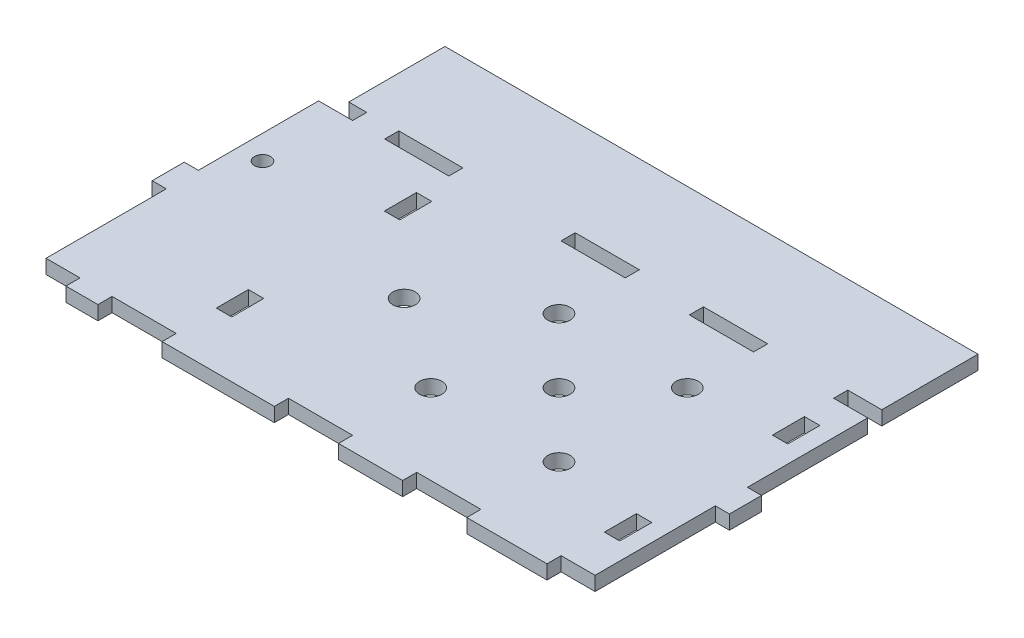
from build123d import *

# Parameters (mm, degrees)
SKETCH1_W           = 25.4
SKETCH1_H           = 5.588
BOSS_EXTRUDE1_DEPTH = 5.588
CUT_EXTRUDE1_REACH  = 152.445
SKETCH9_W           = 6.096
SKETCH9_H           = 12.7
CUT_EXTRUDE2_REACH  = 152.445
SKETCH12_R          = 3.175
CUT_EXTRUDE3_REACH  = 152.445
SKETCH13_R          = 4.445


with BuildPart() as part:
    # Sketch1 → Boss-Extrude1 (new body)
    with BuildSketch(Plane(origin=(0, 0, 0), x_dir=(1, 0, 0), z_dir=(0, 1, 0))):
        Polygon((-108.712, 6.35), (-114.3, 6.35), (-114.3, -6.35), (-108.712, -6.35), (-108.712, -53.975), (-95.25, -53.975), (-95.25, -59.563), (-82.55, -59.563), (-82.55, -53.975), (-57.15, -53.975), (-57.15, -59.563), (-12.7, -59.563), (-12.7, -53.975), (12.7, -53.975), (12.7, -59.563), (38.1, -59.563), (38.1, -53.975), (63.5, -53.975), (63.5, -59.563), (95.25, -59.563), (95.25, -53.975), (108.712, -53.975), (108.712, -6.35), (114.3, -6.35), (114.3, 6.35), (108.712, 6.35), (108.712, 53.975), (95.25, 53.975), (95.25, 59.563), (108.712, 59.563), (108.712, 97.663), (-102.362, 97.663), (-102.362, 59.563), (-95.25, 59.563), (-95.25, 53.975), (-108.712, 53.975), align=None)
        with Locations((-69.85, 56.769)):
            Rectangle(SKETCH1_W, SKETCH1_H, mode=Mode.SUBTRACT)
        with Locations((0, 56.769)):
            Rectangle(SKETCH1_W, SKETCH1_H, mode=Mode.SUBTRACT)
        with Locations((50.8, 56.769)):
            Rectangle(SKETCH1_W, SKETCH1_H, mode=Mode.SUBTRACT)
    extrude(amount=BOSS_EXTRUDE1_DEPTH)

    # Sketch9 → Cut-Extrude1 (cut, up to next)
    with BuildSketch(Plane(origin=(0, 5.588, 0), x_dir=(1, 0, 0), z_dir=(0, 1, 0)), mode=Mode.PRIVATE) as cut_extrude1_sk1:
        with Locations((-54.864, -30.988)):
            Rectangle(SKETCH9_W, SKETCH9_H)
    cut_extrude1_tool1 = extrude(cut_extrude1_sk1.sketch, amount=-CUT_EXTRUDE1_REACH, mode=Mode.PRIVATE) & part.part
    # Sketch9 → Cut-Extrude1 (cut, up to next)
    with BuildSketch(Plane(origin=(0, 5.588, 0), x_dir=(1, 0, 0), z_dir=(0, 1, 0)), mode=Mode.PRIVATE) as cut_extrude1_sk2:
        with Locations((-54.864, 35.56)):
            Rectangle(SKETCH9_W, SKETCH9_H)
    cut_extrude1_tool2 = extrude(cut_extrude1_sk2.sketch, amount=-CUT_EXTRUDE1_REACH, mode=Mode.PRIVATE) & part.part
    # Sketch9 → Cut-Extrude1 (cut, up to next)
    with BuildSketch(Plane(origin=(0, 5.588, 0), x_dir=(1, 0, 0), z_dir=(0, 1, 0)), mode=Mode.PRIVATE) as cut_extrude1_sk3:
        with Locations((98.806, -30.988)):
            Rectangle(SKETCH9_W, SKETCH9_H)
    cut_extrude1_tool3 = extrude(cut_extrude1_sk3.sketch, amount=-CUT_EXTRUDE1_REACH, mode=Mode.PRIVATE) & part.part
    # Sketch9 → Cut-Extrude1 (cut, up to next)
    with BuildSketch(Plane(origin=(0, 5.588, 0), x_dir=(1, 0, 0), z_dir=(0, 1, 0)), mode=Mode.PRIVATE) as cut_extrude1_sk4:
        with Locations((98.806, 35.56)):
            Rectangle(SKETCH9_W, SKETCH9_H)
    cut_extrude1_tool4 = extrude(cut_extrude1_sk4.sketch, amount=-CUT_EXTRUDE1_REACH, mode=Mode.PRIVATE) & part.part
    add(cut_extrude1_tool1.solids().sort_by_distance((-54.864, 5.588, 30.988))[0], mode=Mode.SUBTRACT)
    add(cut_extrude1_tool2.solids().sort_by_distance((-54.864, 5.588, -35.56))[0], mode=Mode.SUBTRACT)
    add(cut_extrude1_tool3.solids().sort_by_distance((98.806, 5.588, 30.988))[0], mode=Mode.SUBTRACT)
    add(cut_extrude1_tool4.solids().sort_by_distance((98.806, 5.588, -35.56))[0], mode=Mode.SUBTRACT)

    # Sketch12 → Cut-Extrude2 (cut, up to next)
    with BuildSketch(Plane(origin=(0, 5.588, 0), x_dir=(1, 0, 0), z_dir=(0, 1, 0)), mode=Mode.PRIVATE) as cut_extrude2_sk1:
        with Locations((-99.187, 22.225)):
            Circle(SKETCH12_R)
    cut_extrude2_tool1 = extrude(cut_extrude2_sk1.sketch, amount=-CUT_EXTRUDE2_REACH, mode=Mode.PRIVATE) & part.part
    add(cut_extrude2_tool1.solids().sort_by_distance((-99.187, 5.588, -22.225))[0], mode=Mode.SUBTRACT)

    # Sketch13 → Cut-Extrude3 (cut, up to next)
    with BuildSketch(Plane.XZ, mode=Mode.PRIVATE) as cut_extrude3_sk1:
        with Locations((62.673131522, 22.225)):
            Circle(SKETCH13_R)
    cut_extrude3_tool1 = extrude(cut_extrude3_sk1.sketch, amount=-CUT_EXTRUDE3_REACH, mode=Mode.PRIVATE) & part.part
    # Sketch13 → Cut-Extrude3 (cut, up to next)
    with BuildSketch(Plane.XZ, mode=Mode.PRIVATE) as cut_extrude3_sk2:
        with Locations((11.873131522, 22.225)):
            Circle(SKETCH13_R)
    cut_extrude3_tool2 = extrude(cut_extrude3_sk2.sketch, amount=-CUT_EXTRUDE3_REACH, mode=Mode.PRIVATE) & part.part
    # Sketch13 → Cut-Extrude3 (cut, up to next)
    with BuildSketch(Plane.XZ, mode=Mode.PRIVATE) as cut_extrude3_sk3:
        with Locations((11.873131522, -28.575)):
            Circle(SKETCH13_R)
    cut_extrude3_tool3 = extrude(cut_extrude3_sk3.sketch, amount=-CUT_EXTRUDE3_REACH, mode=Mode.PRIVATE) & part.part
    # Sketch13 → Cut-Extrude3 (cut, up to next)
    with BuildSketch(Plane.XZ, mode=Mode.PRIVATE) as cut_extrude3_sk4:
        with Locations((62.673131522, -28.575)):
            Circle(SKETCH13_R)
    cut_extrude3_tool4 = extrude(cut_extrude3_sk4.sketch, amount=-CUT_EXTRUDE3_REACH, mode=Mode.PRIVATE) & part.part
    # Sketch13 → Cut-Extrude3 (cut, up to next)
    with BuildSketch(Plane.XZ, mode=Mode.PRIVATE) as cut_extrude3_sk5:
        with Locations((37.273131522, -3.175)):
            Circle(SKETCH13_R)
    cut_extrude3_tool5 = extrude(cut_extrude3_sk5.sketch, amount=-CUT_EXTRUDE3_REACH, mode=Mode.PRIVATE) & part.part
    # Sketch13 → Cut-Extrude3 (cut, up to next)
    with BuildSketch(Plane.XZ, mode=Mode.PRIVATE) as cut_extrude3_sk6:
        with Locations((-24.060880689, -3.175)):
            Circle(SKETCH13_R)
    cut_extrude3_tool6 = extrude(cut_extrude3_sk6.sketch, amount=-CUT_EXTRUDE3_REACH, mode=Mode.PRIVATE) & part.part
    add(cut_extrude3_tool1.solids().sort_by_distance((62.673132, 0, 22.225))[0], mode=Mode.SUBTRACT)
    add(cut_extrude3_tool2.solids().sort_by_distance((11.873132, 0, 22.225))[0], mode=Mode.SUBTRACT)
    add(cut_extrude3_tool3.solids().sort_by_distance((11.873132, 0, -28.575))[0], mode=Mode.SUBTRACT)
    add(cut_extrude3_tool4.solids().sort_by_distance((62.673132, 0, -28.575))[0], mode=Mode.SUBTRACT)
    add(cut_extrude3_tool5.solids().sort_by_distance((37.273132, 0, -3.175))[0], mode=Mode.SUBTRACT)
    add(cut_extrude3_tool6.solids().sort_by_distance((-24.060881, 0, -3.175))[0], mode=Mode.SUBTRACT)


solid = part.part
